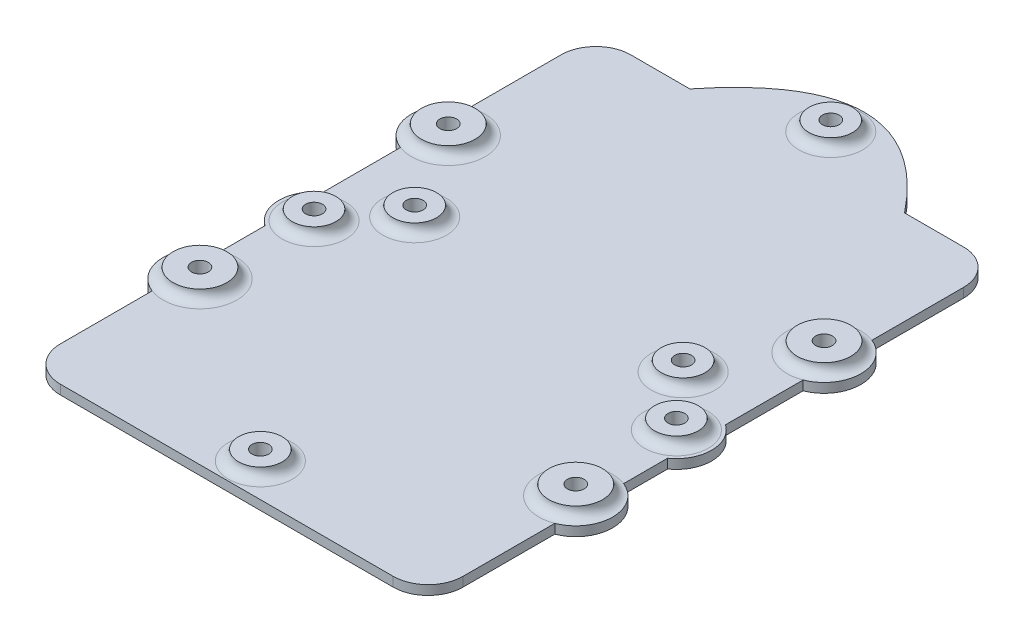
from build123d import *

# Parameters (mm, degrees)
SKETCH2_W             = 60
SKETCH2_H             = 85
BOSS_EXTRUDE1_DEPTH   = 1.4
SKETCH13_R            = 5.25
CUT_EXTRUDE7_DEPTH    = 2
SKETCH13_4_R          = 3.25
SKETCH13_4_R_2        = 1.25
BOSS_EXTRUDE6_DEPTH   = 1.5
BOSS_EXTRUDE6_2_DEPTH = 1.5
BOSS_EXTRUDE6_3_DEPTH = 1.5
SKETCH13_14_R         = 5.25
BOSS_EXTRUDE18_DEPTH  = 1.4
SKETCH13_17_R         = 3.25
SKETCH13_17_R_2       = 1.25
BOSS_EXTRUDE19_DEPTH  = 1.4
SKETCH13_15_R         = 1.25
CUT_EXTRUDE8_DEPTH    = 110.600167471
FILLET9_R             = 1.5
SKETCH11_R            = 3.25
SKETCH11_R_2          = 1.25
BOSS_EXTRUDE5_DEPTH   = 1.5
FILLET1_R             = 5.2
SKETCH11_3_R          = 1.25
CUT_EXTRUDE3_DEPTH    = 110.600167471
FILLET4_R             = 1.5
BOSS_EXTRUDE11_START  = -1.4
SKETCH13_6_R          = 1.25
BOSS_EXTRUDE11_DEPTH  = 1.4
BOSS_EXTRUDE9_DEPTH   = 1.4
SKETCH3_9_R           = 1.25
BOSS_EXTRUDE10_DEPTH  = 1.5
SKETCH3_10_R          = 1.25
CUT_EXTRUDE6_DEPTH    = 111.257361727
FILLET6_R             = 1.5


with BuildPart() as part:
    # Sketch2 → Boss-Extrude1 (new body)
    with BuildSketch(Plane(origin=(0, 0, 0), x_dir=(1, 0, 0), z_dir=(0, 1, 0))):
        with Locations((24.920642049, 40.995798661)):
            Rectangle(SKETCH2_W, SKETCH2_H)
    extrude(amount=-BOSS_EXTRUDE1_DEPTH)

    # Sketch13 → Cut-Extrude7 (cut)
    with BuildSketch(Plane(origin=(0, 0, 0), x_dir=(1, 0, 0), z_dir=(0, 1, 0))):
        with Locations((51.920642049, 38.495798661)):
            Circle(SKETCH13_R)
        with Locations((-2.079357951, 38.495798661)):
            Circle(SKETCH13_R)
    extrude(amount=-CUT_EXTRUDE7_DEPTH, mode=Mode.SUBTRACT)



with BuildPart() as body_2:
    # Sketch13<4> → Boss-Extrude6 (new body)
    with BuildSketch(Plane(origin=(0, 0, 0), x_dir=(1, 0, 0), z_dir=(0, 1, 0))):
        with Locations(Location((51.920642049, 38.495798661, 0), (0, 0, 270))):
            Circle(SKETCH13_4_R)
        with Locations(Location((51.920642049, 38.495798661, 0), (0, 0, 270))):
            Circle(SKETCH13_4_R_2, mode=Mode.SUBTRACT)
    extrude(amount=BOSS_EXTRUDE6_DEPTH)


with BuildPart() as body_3:
    # Sketch13<4> → Boss-Extrude6 2 (new body)
    with BuildSketch(Plane(origin=(0, 0, 0), x_dir=(1, 0, 0), z_dir=(0, 1, 0))):
        with Locations(Location((-2.079357951, 38.495798661, 0), (0, 0, 270))):
            Circle(SKETCH13_4_R)
        with Locations(Location((-2.079357951, 38.495798661, 0), (0, 0, 270))):
            Circle(SKETCH13_4_R_2, mode=Mode.SUBTRACT)
    extrude(amount=BOSS_EXTRUDE6_2_DEPTH)


with BuildPart() as body_4:
    # Sketch13<4> → Boss-Extrude6 3 (new body)
    with BuildSketch(Plane(origin=(0, 0, 0), x_dir=(1, 0, 0), z_dir=(0, 1, 0))):
        with Locations(Location((24.920642049, 88.495798661, 0), (0, 0, 270))):
            Circle(SKETCH13_4_R)
        with Locations(Location((24.920642049, 88.495798661, 0), (0, 0, 270))):
            Circle(SKETCH13_4_R_2, mode=Mode.SUBTRACT)
    extrude(amount=BOSS_EXTRUDE6_3_DEPTH)


with BuildPart() as part_1:
    add(part.part)

    add(body_2.part)  # Boss-Extrude18 merges body 2

    add(body_3.part)  # Boss-Extrude18 merges body 3
    # Sketch13<14> → Boss-Extrude18 (add)
    with BuildSketch(Plane(origin=(0, 0, 0), x_dir=(1, 0, 0), z_dir=(0, 1, 0))):
        with Locations((51.920642049, 38.495798661)):
            Circle(SKETCH13_14_R)
        with Locations((-2.079357951, 38.495798661)):
            Circle(SKETCH13_14_R)
    extrude(amount=-BOSS_EXTRUDE18_DEPTH)


    add(body_4.part)  # Boss-Extrude19 merges body 4
    # Sketch13<17> → Boss-Extrude19 (add)
    # profile 1 of 2: a face of its own
    with BuildSketch(Plane(origin=(0, 0, 0), x_dir=(1, 0, 0), z_dir=(0, 1, 0))):
        with BuildLine():
            Line((8.920642049, 83.495798661), (40.920642049, 83.495798661))
            add(Edge.make_bspline(
                [(40.920642049, 83.495798661), (24.920642049, 103.495798661), (8.920642049, 83.495798661)],
                knots=[0, 0, 0, 1, 1, 1], degree=2))
        make_face()
        with Locations(Location((24.920642049, 88.495798661, 0), (0, 0, 270))):
            Circle(SKETCH13_17_R, mode=Mode.SUBTRACT)
    # profile 2 of 2: a face of its own
    with BuildSketch(Plane(origin=(0, 0, 0), x_dir=(1, 0, 0), z_dir=(0, 1, 0))):
        with Locations(Location((24.920642049, 88.495798661, 0), (0, 0, 270))):
            Circle(SKETCH13_17_R)
        with Locations(Location((24.920642049, 88.495798661, 0), (0, 0, 270))):
            Circle(SKETCH13_17_R_2, mode=Mode.SUBTRACT)
    extrude(amount=-BOSS_EXTRUDE19_DEPTH)

    # Sketch13<15> → Cut-Extrude8 (cut, through all)
    with BuildSketch(Plane(origin=(0, 0, 0), x_dir=(1, 0, 0), z_dir=(0, 1, 0))):
        with Locations(Location((51.920642049, 38.495798661, 0), (0, 0, 270))):
            Circle(SKETCH13_15_R)
        with Locations(Location((-2.079357951, 38.495798661, 0), (0, 0, 270))):
            Circle(SKETCH13_15_R)
    extrude(amount=-CUT_EXTRUDE8_DEPTH, mode=Mode.SUBTRACT)

    # Fillet9
    fillet9_edges = [part_1.edges().sort_by_distance(p)[0] for p in [
        (24.920642049, 0, -91.745798661),
        (51.920642049, 0, -41.745798661),
        (-2.079357951, 0, -41.745798661),
    ]]
    fillet(fillet9_edges, radius=FILLET9_R - 0.0001)  # a hair under: the kernel refuses the full size

    # Sketch11 → Boss-Extrude5 (add)
    # profile 1 of 3: a face of its own
    with BuildSketch(Plane(origin=(0, 0, 0), x_dir=(1, 0, 0), z_dir=(0, 1, 0))):
        with Locations(Location((24.920642049, 3.495798661, 0), (0, 0, 270))):
            Circle(SKETCH11_R)
        with Locations(Location((24.920642049, 3.495798661, 0), (0, 0, 270))):
            Circle(SKETCH11_R_2, mode=Mode.SUBTRACT)
    # profile 2 of 3: a face of its own
    with BuildSketch(Plane(origin=(0, 0, 0), x_dir=(1, 0, 0), z_dir=(0, 1, 0))):
        with Locations(Location((4.920642049, 46.495798661, 0), (0, 0, 270))):
            Circle(SKETCH11_R)
        with Locations(Location((4.920642049, 46.495798661, 0), (0, 0, 270))):
            Circle(SKETCH11_R_2, mode=Mode.SUBTRACT)
    # profile 3 of 3: a face of its own
    with BuildSketch(Plane(origin=(0, 0, 0), x_dir=(1, 0, 0), z_dir=(0, 1, 0))):
        with Locations(Location((44.920642049, 46.495798661, 0), (0, 0, 270))):
            Circle(SKETCH11_R)
        with Locations(Location((44.920642049, 46.495798661, 0), (0, 0, 270))):
            Circle(SKETCH11_R_2, mode=Mode.SUBTRACT)
    extrude(amount=BOSS_EXTRUDE5_DEPTH)

    # Fillet1
    fillet1_edges = [part_1.edges().sort_by_distance(p)[0] for p in [
        (-5.079357951, -0.7, 1.504201339),
        (54.920642049, -0.7, -83.495798661),
        (-5.079357951, -0.7, -83.495798661),
        (54.920642049, -0.7, 1.504201339),
    ]]
    fillet(fillet1_edges, radius=FILLET1_R)

    # Sketch11<3> → Cut-Extrude3 (cut, through all)
    with BuildSketch(Plane(origin=(0, 0, 0), x_dir=(1, 0, 0), z_dir=(0, 1, 0))):
        with Locations(Location((24.920642049, 3.495798661, 0), (0, 0, 270))):
            Circle(SKETCH11_3_R)
        with Locations(Location((44.920642049, 46.495798661, 0), (0, 0, 270))):
            Circle(SKETCH11_3_R)
        with Locations(Location((4.920642049, 46.495798661, 0), (0, 0, 270))):
            Circle(SKETCH11_3_R)
    extrude(amount=-CUT_EXTRUDE3_DEPTH, mode=Mode.SUBTRACT)

    # Fillet4
    fillet4_edges = [part_1.edges().sort_by_distance(p)[0] for p in [
        (24.920642049, 0, -6.745798661),
        (4.920642049, 0, -49.745798661),
        (44.920642049, 0, -49.745798661),
    ]]
    fillet(fillet4_edges, radius=FILLET4_R - 0.0001)  # a hair under: the kernel refuses the full size

    # Sketch13<6> → Boss-Extrude11 (add)
    # profile 1 of 2: a face of its own
    with BuildSketch(Plane(origin=(0, 0, 0), x_dir=(1, 0, 0), z_dir=(0, 1, 0)).offset(BOSS_EXTRUDE11_START)):
        with BuildLine():
            ThreePointArc((1.170642049, 38.495798661), (-1.441980511, 41.682685857), (-5.079357951, 39.745798661))
            Line((-5.079357951, 39.745798661), (-5.079357951, 37.245798661))
            ThreePointArc((-5.079357951, 37.245798661), (-1.441980511, 35.308911465), (1.170642049, 38.495798661))
        make_face()
        with Locations(Location((-2.079357951, 38.495798661, 0), (0, 0, 270))):
            Circle(SKETCH13_6_R, mode=Mode.SUBTRACT)
    # profile 2 of 2: a face of its own
    with BuildSketch(Plane(origin=(0, 0, 0), x_dir=(1, 0, 0), z_dir=(0, 1, 0)).offset(BOSS_EXTRUDE11_START)):
        with BuildLine():
            Line((54.920642049, 37.245798661), (54.920642049, 39.745798661))
            ThreePointArc((54.920642049, 39.745798661), (48.670642049, 38.495798661), (54.920642049, 37.245798661))
        make_face()
        with Locations(Location((51.920642049, 38.495798661, 0), (0, 0, 270))):
            Circle(SKETCH13_6_R, mode=Mode.SUBTRACT)
    extrude(amount=BOSS_EXTRUDE11_DEPTH)

    # Sketch3 → Boss-Extrude9 (add)
    with BuildSketch(Plane(origin=(0, 0, 0), x_dir=(1, 0, 0), z_dir=(0, 1, 0))):
        with BuildLine():
            ThreePointArc((54.920642049, 27.619274044), (47.420642049, 22.495798661), (54.920642049, 17.372323278))
            Line((54.920642049, 17.372323278), (54.920642049, 19.031697046))
            ThreePointArc((54.920642049, 19.031697046), (48.920642049, 22.495798661), (54.920642049, 25.959900276))
            Line((54.920642049, 25.959900276), (54.920642049, 27.619274044))
        make_face()
        with BuildLine():
            Line((54.920642049, 19.031697046), (54.920642049, 17.372323278))
            ThreePointArc((54.920642049, 17.372323278), (57.46211758, 19.393380249), (58.420642049, 22.495798661))
            ThreePointArc((58.420642049, 22.495798661), (57.46211758, 25.598217072), (54.920642049, 27.619274044))
            Line((54.920642049, 27.619274044), (54.920642049, 25.959900276))
            ThreePointArc((54.920642049, 25.959900276), (56.384743664, 24.495798661), (56.920642049, 22.495798661))
            ThreePointArc((56.920642049, 22.495798661), (56.384743664, 20.495798661), (54.920642049, 19.031697046))
        make_face()
        with BuildLine():
            Line((54.920642049, 25.959900276), (54.920642049, 19.031697046))
            ThreePointArc((54.920642049, 19.031697046), (56.384743664, 20.495798661), (56.920642049, 22.495798661))
            ThreePointArc((56.920642049, 22.495798661), (56.384743664, 24.495798661), (54.920642049, 25.959900276))
        make_face()
        with BuildLine():
            Line((54.920642049, 62.959900276), (54.920642049, 56.031697046))
            ThreePointArc((54.920642049, 56.031697046), (56.384743664, 57.495798661), (56.920642049, 59.495798661))
            ThreePointArc((56.920642049, 59.495798661), (56.384743664, 61.495798661), (54.920642049, 62.959900276))
        make_face()
        with BuildLine():
            ThreePointArc((54.920642049, 64.619274044), (47.420642049, 59.495798661), (54.920642049, 54.372323278))
            Line((54.920642049, 54.372323278), (54.920642049, 56.031697046))
            ThreePointArc((54.920642049, 56.031697046), (48.920642049, 59.495798661), (54.920642049, 62.959900276))
            Line((54.920642049, 62.959900276), (54.920642049, 64.619274044))
        make_face()
        with BuildLine():
            Line((54.920642049, 56.031697046), (54.920642049, 54.372323278))
            ThreePointArc((54.920642049, 54.372323278), (57.46211758, 56.393380249), (58.420642049, 59.495798661))
            ThreePointArc((58.420642049, 59.495798661), (57.46211758, 62.598217072), (54.920642049, 64.619274044))
            Line((54.920642049, 64.619274044), (54.920642049, 62.959900276))
            ThreePointArc((54.920642049, 62.959900276), (56.384743664, 61.495798661), (56.920642049, 59.495798661))
            ThreePointArc((56.920642049, 59.495798661), (56.384743664, 57.495798661), (54.920642049, 56.031697046))
        make_face()
        with BuildLine():
            Line((-5.079357951, 19.031697046), (-5.079357951, 25.959900276))
            ThreePointArc((-5.079357951, 25.959900276), (-7.079357951, 22.495798661), (-5.079357951, 19.031697046))
        make_face()
        with BuildLine():
            ThreePointArc((2.420642049, 22.495798661), (0.023060461, 27.037274192), (-5.079357951, 27.619274044))
            Line((-5.079357951, 27.619274044), (-5.079357951, 25.959900276))
            ThreePointArc((-5.079357951, 25.959900276), (-1.079357951, 25.959900276), (0.920642049, 22.495798661))
            ThreePointArc((0.920642049, 22.495798661), (-1.079357951, 19.031697046), (-5.079357951, 19.031697046))
            Line((-5.079357951, 19.031697046), (-5.079357951, 17.372323278))
            ThreePointArc((-5.079357951, 17.372323278), (0.023060461, 17.95432313), (2.420642049, 22.495798661))
        make_face()
        with BuildLine():
            Line((-5.079357951, 25.959900276), (-5.079357951, 27.619274044))
            ThreePointArc((-5.079357951, 27.619274044), (-8.579357951, 22.495798661), (-5.079357951, 17.372323278))
            Line((-5.079357951, 17.372323278), (-5.079357951, 19.031697046))
            ThreePointArc((-5.079357951, 19.031697046), (-7.079357951, 22.495798661), (-5.079357951, 25.959900276))
        make_face()
        with BuildLine():
            Line((-5.079357951, 56.031697046), (-5.079357951, 62.959900276))
            ThreePointArc((-5.079357951, 62.959900276), (-7.079357951, 59.495798661), (-5.079357951, 56.031697046))
        make_face()
        with BuildLine():
            ThreePointArc((2.420642049, 59.495798661), (0.023060461, 64.037274192), (-5.079357951, 64.619274044))
            Line((-5.079357951, 64.619274044), (-5.079357951, 62.959900276))
            ThreePointArc((-5.079357951, 62.959900276), (-1.079357951, 62.959900276), (0.920642049, 59.495798661))
            ThreePointArc((0.920642049, 59.495798661), (-1.079357951, 56.031697046), (-5.079357951, 56.031697046))
            Line((-5.079357951, 56.031697046), (-5.079357951, 54.372323278))
            ThreePointArc((-5.079357951, 54.372323278), (0.023060461, 54.95432313), (2.420642049, 59.495798661))
        make_face()
        with BuildLine():
            Line((-5.079357951, 62.959900276), (-5.079357951, 64.619274044))
            ThreePointArc((-5.079357951, 64.619274044), (-8.579357951, 59.495798661), (-5.079357951, 54.372323278))
            Line((-5.079357951, 54.372323278), (-5.079357951, 56.031697046))
            ThreePointArc((-5.079357951, 56.031697046), (-7.079357951, 59.495798661), (-5.079357951, 62.959900276))
        make_face()
    extrude(amount=-BOSS_EXTRUDE9_DEPTH)

    # Sketch3<9> → Boss-Extrude10 (add)
    # profile 1 of 8: a face of its own
    with BuildSketch(Plane(origin=(0, 0, 0), x_dir=(1, 0, 0), z_dir=(0, 1, 0))):
        with BuildLine():
            ThreePointArc((54.920642049, 25.959900276), (48.920642049, 22.495798661), (54.920642049, 19.031697046))
            Line((54.920642049, 19.031697046), (54.920642049, 25.959900276))
        make_face()
        with Locations(Location((52.920642049, 22.495798661, 0), (0, 0, 270))):
            Circle(SKETCH3_9_R, mode=Mode.SUBTRACT)
    # profile 2 of 8: a face of its own
    with BuildSketch(Plane(origin=(0, 0, 0), x_dir=(1, 0, 0), z_dir=(0, 1, 0))):
        with BuildLine():
            Line((54.920642049, 25.959900276), (54.920642049, 19.031697046))
            ThreePointArc((54.920642049, 19.031697046), (56.384743664, 20.495798661), (56.920642049, 22.495798661))
            ThreePointArc((56.920642049, 22.495798661), (56.384743664, 24.495798661), (54.920642049, 25.959900276))
        make_face()
    # profile 3 of 8: a face of its own
    with BuildSketch(Plane(origin=(0, 0, 0), x_dir=(1, 0, 0), z_dir=(0, 1, 0))):
        with BuildLine():
            ThreePointArc((0.920642049, 22.495798661), (-1.079357951, 25.959900276), (-5.079357951, 25.959900276))
            Line((-5.079357951, 25.959900276), (-5.079357951, 19.031697046))
            ThreePointArc((-5.079357951, 19.031697046), (-1.079357951, 19.031697046), (0.920642049, 22.495798661))
        make_face()
        with Locations(Location((-3.079357951, 22.495798661, 0), (0, 0, 270))):
            Circle(SKETCH3_9_R, mode=Mode.SUBTRACT)
    # profile 4 of 8: a face of its own
    with BuildSketch(Plane(origin=(0, 0, 0), x_dir=(1, 0, 0), z_dir=(0, 1, 0))):
        with BuildLine():
            Line((-5.079357951, 19.031697046), (-5.079357951, 25.959900276))
            ThreePointArc((-5.079357951, 25.959900276), (-7.079357951, 22.495798661), (-5.079357951, 19.031697046))
        make_face()
    # profile 5 of 8: a face of its own
    with BuildSketch(Plane(origin=(0, 0, 0), x_dir=(1, 0, 0), z_dir=(0, 1, 0))):
        with BuildLine():
            ThreePointArc((0.920642049, 59.495798661), (-1.079357951, 62.959900276), (-5.079357951, 62.959900276))
            Line((-5.079357951, 62.959900276), (-5.079357951, 56.031697046))
            ThreePointArc((-5.079357951, 56.031697046), (-1.079357951, 56.031697046), (0.920642049, 59.495798661))
        make_face()
        with Locations(Location((-3.079357951, 59.495798661, 0), (0, 0, 270))):
            Circle(SKETCH3_9_R, mode=Mode.SUBTRACT)
    # profile 6 of 8: a face of its own
    with BuildSketch(Plane(origin=(0, 0, 0), x_dir=(1, 0, 0), z_dir=(0, 1, 0))):
        with BuildLine():
            Line((-5.079357951, 56.031697046), (-5.079357951, 62.959900276))
            ThreePointArc((-5.079357951, 62.959900276), (-7.079357951, 59.495798661), (-5.079357951, 56.031697046))
        make_face()
    # profile 7 of 8: a face of its own
    with BuildSketch(Plane(origin=(0, 0, 0), x_dir=(1, 0, 0), z_dir=(0, 1, 0))):
        with BuildLine():
            Line((54.920642049, 62.959900276), (54.920642049, 56.031697046))
            ThreePointArc((54.920642049, 56.031697046), (56.384743664, 57.495798661), (56.920642049, 59.495798661))
            ThreePointArc((56.920642049, 59.495798661), (56.384743664, 61.495798661), (54.920642049, 62.959900276))
        make_face()
    # profile 8 of 8: a face of its own
    with BuildSketch(Plane(origin=(0, 0, 0), x_dir=(1, 0, 0), z_dir=(0, 1, 0))):
        with BuildLine():
            ThreePointArc((54.920642049, 62.959900276), (48.920642049, 59.495798661), (54.920642049, 56.031697046))
            Line((54.920642049, 56.031697046), (54.920642049, 62.959900276))
        make_face()
        with Locations(Location((52.920642049, 59.495798661, 0), (0, 0, 270))):
            Circle(SKETCH3_9_R, mode=Mode.SUBTRACT)
    extrude(amount=BOSS_EXTRUDE10_DEPTH)

    # Sketch3<10> → Cut-Extrude6 (cut, through all)
    with BuildSketch(Plane(origin=(0, 0, 0), x_dir=(1, 0, 0), z_dir=(0, 1, 0))):
        with Locations(Location((52.920642049, 22.495798661, 0), (0, 0, 270))):
            Circle(SKETCH3_10_R)
        with Locations(Location((-3.079357951, 22.495798661, 0), (0, 0, 270))):
            Circle(SKETCH3_10_R)
        with Locations(Location((52.920642049, 59.495798661, 0), (0, 0, 270))):
            Circle(SKETCH3_10_R)
        with Locations(Location((-3.079357951, 59.495798661, 0), (0, 0, 270))):
            Circle(SKETCH3_10_R)
    extrude(amount=-CUT_EXTRUDE6_DEPTH, mode=Mode.SUBTRACT)

    # Fillet6
    fillet6_edges = [part_1.edges().sort_by_distance(p)[0] for p in [
        (50.920642049, 0, -25.959900276),
        (-1.079357951, 0, -19.031697046),
        (-1.079357951, 0, -56.031697046),
        (50.920642049, 0, -62.959900276),
    ]]
    fillet(fillet6_edges, radius=FILLET6_R - 0.0001)  # a hair under: the kernel refuses the full size


solid = part_1.part
